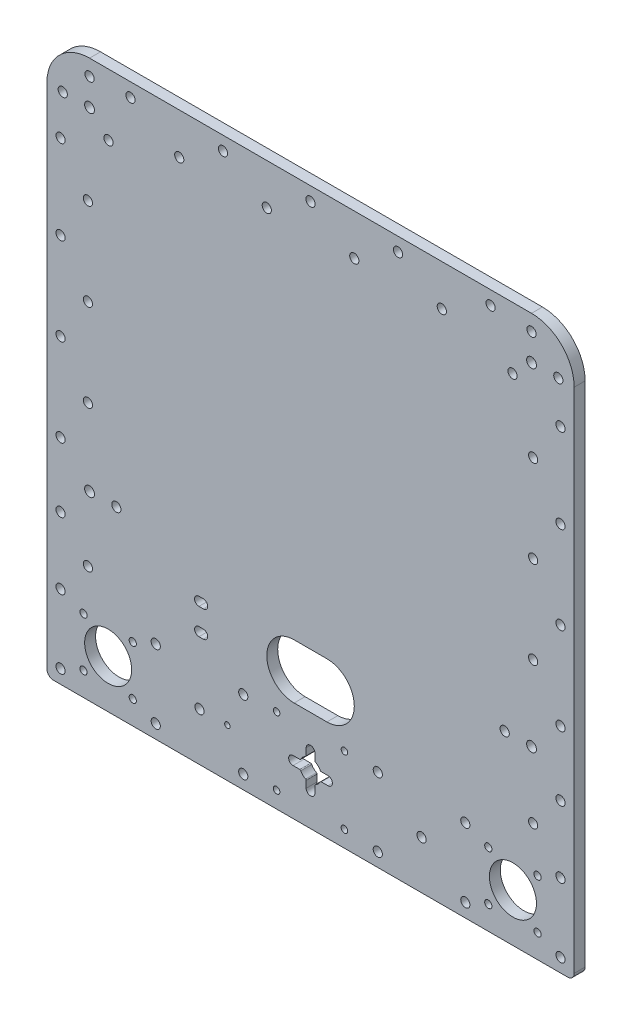
from build123d import *

# Parameters (mm, degrees)
CONVERT_SOLID1_START       = -5
CONVERT_SOLID1_OUTLINE_R   = 2.1
CONVERT_SOLID1_OUTLINE_R_2 = 1.65
CONVERT_SOLID1_OUTLINE_R_3 = 10.75
CONVERT_SOLID1_OUTLINE_R_4 = 1.25
CONVERT_SOLID1_OUTLINE_R_5 = 1.5
CONVERT_SOLID1_OUTLINE_R_6 = 2.25
CONVERT_SOLID1_DEPTH       = 5


# Read off the part's stored shape, not the designer's step: Convert-Solid1
with BuildPart() as part:
    # Convert-Solid1 outline → Convert-Solid1 (new body)
    with BuildSketch(Plane.XY.offset(CONVERT_SOLID1_START)):
        with BuildLine():
            Line((221.5, 254.5), (19.5, 254.5))
            ThreePointArc((19.5, 254.5), (5.711417767, 248.788582233), (0, 235))
            Line((0, 235), (0, 3))
            ThreePointArc((0, 3), (0.878679656, 0.878679656), (3, 0))
            Line((3, 0), (238, 0))
            ThreePointArc((238, 0), (240.121320344, 0.878679656), (241, 3))
            Line((241, 3), (241, 235))
            ThreePointArc((241, 235), (235.288582233, 248.788582233), (221.5, 254.5))
        make_face()
        with Locations((6.25, 6.25)):
            Circle(CONVERT_SOLID1_OUTLINE_R, mode=Mode.SUBTRACT)
        with Locations((16.75, 10.75)):
            Circle(CONVERT_SOLID1_OUTLINE_R_2, mode=Mode.SUBTRACT)
        with Locations((28, 22)):
            Circle(CONVERT_SOLID1_OUTLINE_R_3, mode=Mode.SUBTRACT)
        with Locations((39.25, 10.75)):
            Circle(CONVERT_SOLID1_OUTLINE_R_2, mode=Mode.SUBTRACT)
        with Locations((49.75, 6.25)):
            Circle(CONVERT_SOLID1_OUTLINE_R, mode=Mode.SUBTRACT)
        with Locations((6.25, 37.75)):
            Circle(CONVERT_SOLID1_OUTLINE_R, mode=Mode.SUBTRACT)
        with Locations((16.75, 33.25)):
            Circle(CONVERT_SOLID1_OUTLINE_R_2, mode=Mode.SUBTRACT)
        with Locations((18.75, 53)):
            Circle(CONVERT_SOLID1_OUTLINE_R, mode=Mode.SUBTRACT)
        with Locations((39.25, 33.25)):
            Circle(CONVERT_SOLID1_OUTLINE_R_2, mode=Mode.SUBTRACT)
        with Locations((49.75, 37.75)):
            Circle(CONVERT_SOLID1_OUTLINE_R, mode=Mode.SUBTRACT)
        with Locations((89.75, 6.25)):
            Circle(CONVERT_SOLID1_OUTLINE_R, mode=Mode.SUBTRACT)
        with Locations((69.75, 22)):
            Circle(CONVERT_SOLID1_OUTLINE_R, mode=Mode.SUBTRACT)
        with Locations((82.5, 22)):
            Circle(CONVERT_SOLID1_OUTLINE_R_4, mode=Mode.SUBTRACT)
        with Locations((105, 7.5)):
            Circle(CONVERT_SOLID1_OUTLINE_R_5, mode=Mode.SUBTRACT)
        with Locations((89.75, 37.75)):
            Circle(CONVERT_SOLID1_OUTLINE_R, mode=Mode.SUBTRACT)
        with BuildLine():
            ThreePointArc((71.5, 54.5), (73.5, 52.5), (71.5, 50.5))
            Line((71.5, 50.5), (69.5, 50.5))
            ThreePointArc((69.5, 50.5), (67.5, 52.5), (69.5, 54.5))
            Line((69.5, 54.5), (71.5, 54.5))
        make_face(mode=Mode.SUBTRACT)
        with Locations((105, 38.5)):
            Circle(CONVERT_SOLID1_OUTLINE_R_5, mode=Mode.SUBTRACT)
        with Locations((6.25, 68.25)):
            Circle(CONVERT_SOLID1_OUTLINE_R, mode=Mode.SUBTRACT)
        with Locations((19.5, 83)):
            Circle(CONVERT_SOLID1_OUTLINE_R_6, mode=Mode.SUBTRACT)
        with Locations((31.75, 83)):
            Circle(CONVERT_SOLID1_OUTLINE_R, mode=Mode.SUBTRACT)
        with Locations((6.25, 97.75)):
            Circle(CONVERT_SOLID1_OUTLINE_R, mode=Mode.SUBTRACT)
        with Locations((18.75, 117.75)):
            Circle(CONVERT_SOLID1_OUTLINE_R, mode=Mode.SUBTRACT)
        with BuildLine():
            ThreePointArc((71.5, 66.5), (73.5, 64.5), (71.5, 62.5))
            Line((71.5, 62.5), (69.5, 62.5))
            ThreePointArc((69.5, 62.5), (67.5, 64.5), (69.5, 66.5))
            Line((69.5, 66.5), (71.5, 66.5))
        make_face(mode=Mode.SUBTRACT)
        with Locations((136, 7.5)):
            Circle(CONVERT_SOLID1_OUTLINE_R_5, mode=Mode.SUBTRACT)
        with BuildLine():
            ThreePointArc((122.5, 15), (120.5, 13), (118.5, 15))
            Line((118.5, 15), (118.5, 18.101020514))
            ThreePointArc((118.5, 18.101020514), (118.426401433, 18.362136998), (118.227272727, 18.546382286))
            ThreePointArc((118.227272727, 18.546382286), (116.964466094, 19.464466094), (116.046382286, 20.727272727))
            ThreePointArc((116.046382286, 20.727272727), (115.862136998, 20.926401433), (115.601020514, 21))
            Line((115.601020514, 21), (112.5, 21))
            ThreePointArc((112.5, 21), (110.5, 23), (112.5, 25))
            Line((112.5, 25), (115.601020514, 25))
            ThreePointArc((115.601020514, 25), (115.862136998, 25.073598567), (116.046382286, 25.272727273))
            ThreePointArc((116.046382286, 25.272727273), (116.964466093, 26.535533904), (118.227272723, 27.453617712))
            ThreePointArc((118.227272723, 27.453617712), (118.426401429, 27.637862999), (118.499999996, 27.898979483))
            Line((118.499999996, 27.898979483), (118.499999996, 31.000000005))
            ThreePointArc((118.499999996, 31.000000005), (120.5, 33.00000001), (122.500000004, 31.000000005))
            Line((122.500000004, 31.000000005), (122.500000004, 27.898979483))
            ThreePointArc((122.500000004, 27.898979483), (122.573598571, 27.637862999), (122.772727277, 27.453617712))
            ThreePointArc((122.772727277, 27.453617712), (124.035533907, 26.535533904), (124.953617714, 25.272727273))
            ThreePointArc((124.953617714, 25.272727273), (125.137863002, 25.073598567), (125.398979486, 25))
            Line((125.398979486, 25), (128.5, 25))
            ThreePointArc((128.5, 25), (130.5, 23), (128.5, 21))
            Line((128.5, 21), (125.398979486, 21))
            ThreePointArc((125.398979486, 21), (125.137863002, 20.926401433), (124.953617714, 20.727272727))
            ThreePointArc((124.953617714, 20.727272727), (124.035533906, 19.464466094), (122.772727273, 18.546382286))
            ThreePointArc((122.772727273, 18.546382286), (122.573598567, 18.362136998), (122.5, 18.101020514))
            Line((122.5, 18.101020514), (122.5, 15))
        make_face(mode=Mode.SUBTRACT)
        with Locations((151.25, 6.25)):
            Circle(CONVERT_SOLID1_OUTLINE_R, mode=Mode.SUBTRACT)
        with Locations((171.25, 22)):
            Circle(CONVERT_SOLID1_OUTLINE_R, mode=Mode.SUBTRACT)
        with Locations((136, 38.5)):
            Circle(CONVERT_SOLID1_OUTLINE_R_5, mode=Mode.SUBTRACT)
        with BuildLine():
            ThreePointArc((128, 71), (140.5, 58.5), (128, 46))
            Line((128, 46), (113, 46))
            ThreePointArc((113, 46), (100.5, 58.5), (113, 71))
            Line((113, 71), (128, 71))
        make_face(mode=Mode.SUBTRACT)
        with Locations((151.25, 37.75)):
            Circle(CONVERT_SOLID1_OUTLINE_R, mode=Mode.SUBTRACT)
        with Locations((191.25, 6.25)):
            Circle(CONVERT_SOLID1_OUTLINE_R, mode=Mode.SUBTRACT)
        with Locations((201.75, 10.75)):
            Circle(CONVERT_SOLID1_OUTLINE_R_2, mode=Mode.SUBTRACT)
        with Locations((224.25, 10.75)):
            Circle(CONVERT_SOLID1_OUTLINE_R_2, mode=Mode.SUBTRACT)
        with Locations((234.75, 6.25)):
            Circle(CONVERT_SOLID1_OUTLINE_R, mode=Mode.SUBTRACT)
        with Locations((213, 22)):
            Circle(CONVERT_SOLID1_OUTLINE_R_3, mode=Mode.SUBTRACT)
        with Locations((191.25, 37.75)):
            Circle(CONVERT_SOLID1_OUTLINE_R, mode=Mode.SUBTRACT)
        with Locations((201.75, 33.25)):
            Circle(CONVERT_SOLID1_OUTLINE_R_2, mode=Mode.SUBTRACT)
        with Locations((224.25, 33.25)):
            Circle(CONVERT_SOLID1_OUTLINE_R_2, mode=Mode.SUBTRACT)
        with Locations((234.75, 37.75)):
            Circle(CONVERT_SOLID1_OUTLINE_R, mode=Mode.SUBTRACT)
        with Locations((222.25, 53)):
            Circle(CONVERT_SOLID1_OUTLINE_R, mode=Mode.SUBTRACT)
        with Locations((209.25, 83)):
            Circle(CONVERT_SOLID1_OUTLINE_R, mode=Mode.SUBTRACT)
        with Locations((234.75, 68.25)):
            Circle(CONVERT_SOLID1_OUTLINE_R, mode=Mode.SUBTRACT)
        with Locations((221.5, 83)):
            Circle(CONVERT_SOLID1_OUTLINE_R_6, mode=Mode.SUBTRACT)
        with Locations((234.75, 97.75)):
            Circle(CONVERT_SOLID1_OUTLINE_R, mode=Mode.SUBTRACT)
        with Locations((222.25, 117.75)):
            Circle(CONVERT_SOLID1_OUTLINE_R, mode=Mode.SUBTRACT)
        with Locations((6.25, 137.75)):
            Circle(CONVERT_SOLID1_OUTLINE_R, mode=Mode.SUBTRACT)
        with Locations((18.75, 157.75)):
            Circle(CONVERT_SOLID1_OUTLINE_R, mode=Mode.SUBTRACT)
        with Locations((6.25, 177.75)):
            Circle(CONVERT_SOLID1_OUTLINE_R, mode=Mode.SUBTRACT)
        with Locations((18.75, 197.75)):
            Circle(CONVERT_SOLID1_OUTLINE_R, mode=Mode.SUBTRACT)
        with Locations((6.25, 216.291713066)):
            Circle(CONVERT_SOLID1_OUTLINE_R, mode=Mode.SUBTRACT)
        with Locations((7.25, 235)):
            Circle(CONVERT_SOLID1_OUTLINE_R, mode=Mode.SUBTRACT)
        with Locations((28.16205807, 226.33794193)):
            Circle(CONVERT_SOLID1_OUTLINE_R, mode=Mode.SUBTRACT)
        with Locations((19.5, 235)):
            Circle(CONVERT_SOLID1_OUTLINE_R_6, mode=Mode.SUBTRACT)
        with Locations((19.5, 247.25)):
            Circle(CONVERT_SOLID1_OUTLINE_R, mode=Mode.SUBTRACT)
        with Locations((38.208286934, 248.25)):
            Circle(CONVERT_SOLID1_OUTLINE_R, mode=Mode.SUBTRACT)
        with Locations((60.5, 235.75)):
            Circle(CONVERT_SOLID1_OUTLINE_R, mode=Mode.SUBTRACT)
        with Locations((80.5, 248.25)):
            Circle(CONVERT_SOLID1_OUTLINE_R, mode=Mode.SUBTRACT)
        with Locations((100.5, 235.75)):
            Circle(CONVERT_SOLID1_OUTLINE_R, mode=Mode.SUBTRACT)
        with Locations((234.75, 137.75)):
            Circle(CONVERT_SOLID1_OUTLINE_R, mode=Mode.SUBTRACT)
        with Locations((222.25, 157.75)):
            Circle(CONVERT_SOLID1_OUTLINE_R, mode=Mode.SUBTRACT)
        with Locations((234.75, 177.75)):
            Circle(CONVERT_SOLID1_OUTLINE_R, mode=Mode.SUBTRACT)
        with Locations((140.5, 235.75)):
            Circle(CONVERT_SOLID1_OUTLINE_R, mode=Mode.SUBTRACT)
        with Locations((120.5, 248.25)):
            Circle(CONVERT_SOLID1_OUTLINE_R, mode=Mode.SUBTRACT)
        with Locations((180.5, 235.75)):
            Circle(CONVERT_SOLID1_OUTLINE_R, mode=Mode.SUBTRACT)
        with Locations((160.5, 248.25)):
            Circle(CONVERT_SOLID1_OUTLINE_R, mode=Mode.SUBTRACT)
        with Locations((222.25, 197.75)):
            Circle(CONVERT_SOLID1_OUTLINE_R, mode=Mode.SUBTRACT)
        with Locations((234.75, 216.291713066)):
            Circle(CONVERT_SOLID1_OUTLINE_R, mode=Mode.SUBTRACT)
        with Locations((202.791713066, 248.25)):
            Circle(CONVERT_SOLID1_OUTLINE_R, mode=Mode.SUBTRACT)
        with Locations((212.83794193, 226.33794193)):
            Circle(CONVERT_SOLID1_OUTLINE_R, mode=Mode.SUBTRACT)
        with Locations((221.5, 235)):
            Circle(CONVERT_SOLID1_OUTLINE_R_6, mode=Mode.SUBTRACT)
        with Locations((233.75, 235)):
            Circle(CONVERT_SOLID1_OUTLINE_R, mode=Mode.SUBTRACT)
        with Locations((221.5, 247.25)):
            Circle(CONVERT_SOLID1_OUTLINE_R, mode=Mode.SUBTRACT)
    extrude(amount=CONVERT_SOLID1_DEPTH)


solid = part.part
